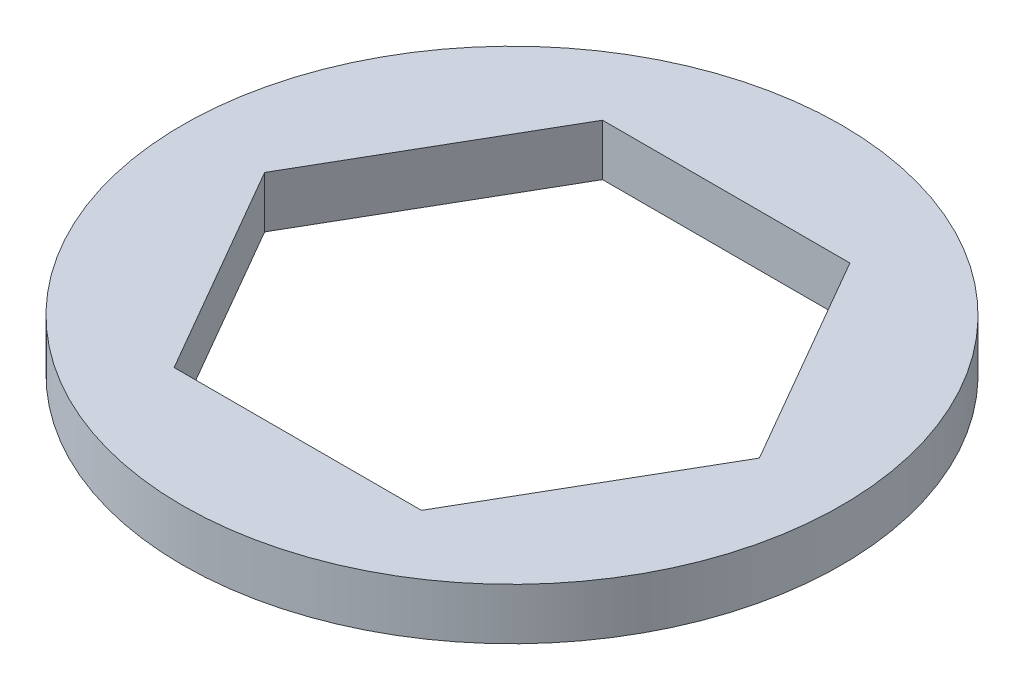
from build123d import *

# Parameters (mm, degrees)
SKETCH1_R           = 10.16
BOSS_EXTRUDE1_DEPTH = 0.79375


with BuildPart() as part:
    # Sketch1 → Boss-Extrude1 (new, symmetric)
    with BuildSketch(Plane(origin=(0, 0, 0), x_dir=(1, 0, 0), z_dir=(0, 1, 0))):
        Circle(SKETCH1_R)
        Polygon((7.625642355, 0), (3.812821178, 6.604), (-3.812821178, 6.604), (-7.625642355, 0), (-3.812821178, -6.604), (3.812821178, -6.604), align=None, mode=Mode.SUBTRACT)
    extrude(amount=BOSS_EXTRUDE1_DEPTH, both=True)


solid = part.part
